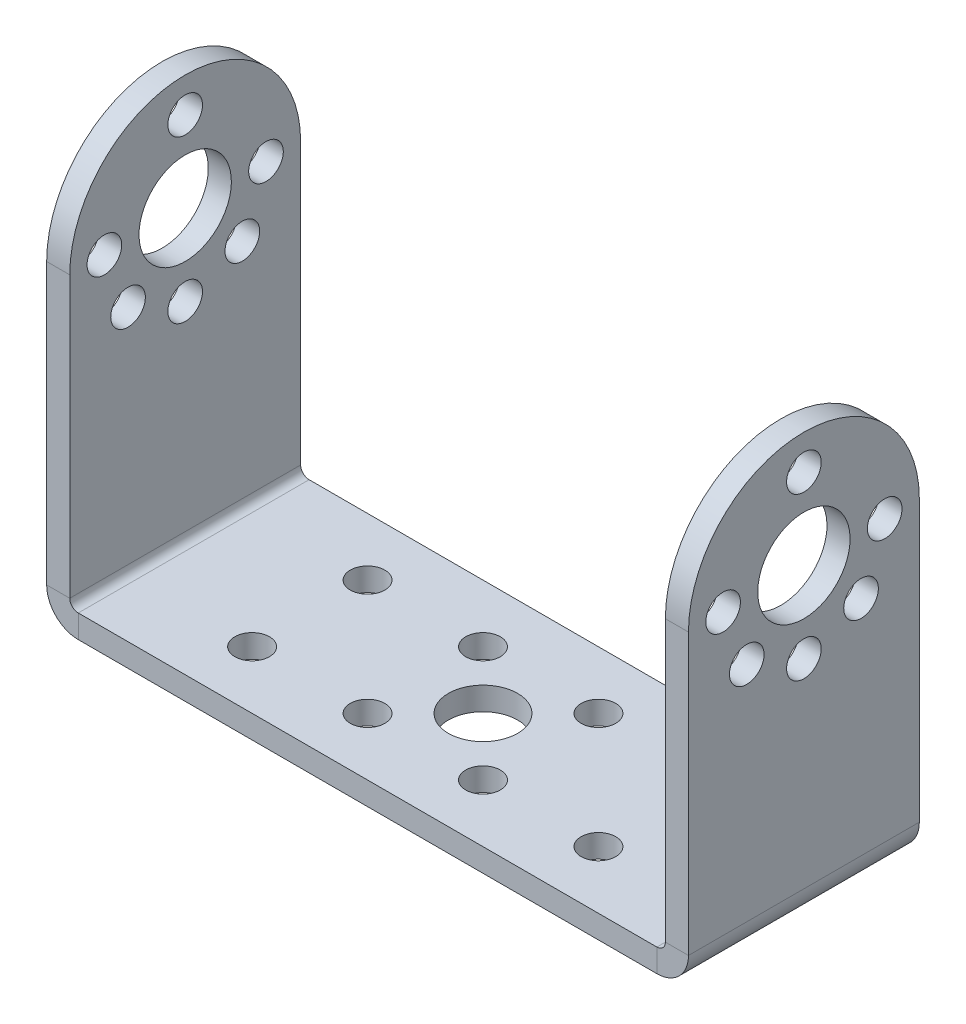
from build123d import *

# Parameters (mm, degrees)
SKETCH_1_W                         = 55.6
SKETCH_1_H                         = 20
SM_BASE_FLANGE_1_DEPTH             = 2
SM_EDGE_FLANGE_1_STRIP_W           = 9.4732
SM_EDGE_FLANGE_1_STRIP_H           = 2
SM_EDGE_FLANGE_1_STRIP_CUT_DEPTH   = 20
SM_EDGE_FLANGE_1_STRIP_2_W         = 9.4732
SM_EDGE_FLANGE_1_STRIP_2_H         = 2
SM_EDGE_FLANGE_1_STRIP_CUT_2_DEPTH = 20
SM_EDGE_FLANGE_1_DEPTH             = 20
SM_EDGE_FLANGE_1_BEND_DEPTH        = 20
SKETCH_12_R                        = 1.5
CUT_EXTRUDE_1_DEPTH                = 67.45569953
SKETCH_13_R                        = 3
SKETCH_13_R_2                      = 1.5
CUT_EXTRUDE_2_DEPTH                = 48.348072822


# Sheet-metal steps are written as plain solids
with BuildPart() as part:
    # Sketch 1 → 基体-法兰1 (new body)
    with BuildSketch(Plane(origin=(0, 0, 0), x_dir=(1, 0, 0), z_dir=(0, 1, 0))):
        Rectangle(SKETCH_1_W, SKETCH_1_H)
    extrude(amount=-SM_BASE_FLANGE_1_DEPTH)

    # 边线-法兰1 strip (across the edge) → 边线-法兰1 strip cut (cut)
    with BuildSketch(Plane(origin=(-27.8, 0, -10), x_dir=(1, 0, 0), z_dir=(0, 0, 1))):
        with Locations((-2, -1)):
            Rectangle(SM_EDGE_FLANGE_1_STRIP_W, SM_EDGE_FLANGE_1_STRIP_H)
    extrude(amount=SM_EDGE_FLANGE_1_STRIP_CUT_DEPTH, mode=Mode.SUBTRACT)

    # 边线-法兰1 strip 2 (across the edge) → 边线-法兰1 strip cut 2 (cut)
    with BuildSketch(Plane(origin=(27.8, 0, 10), x_dir=(-1, 0, 0), z_dir=(0, 0, -1))):
        with Locations((-2, -1)):
            Rectangle(SM_EDGE_FLANGE_1_STRIP_2_W, SM_EDGE_FLANGE_1_STRIP_2_H)
    extrude(amount=SM_EDGE_FLANGE_1_STRIP_CUT_2_DEPTH, mode=Mode.SUBTRACT)

    # 边线-法兰1 section (across the edge) → 边线-法兰1 (add)
    with BuildSketch(Plane(origin=(-27.8, 0, -10), x_dir=(1, 0, 0), z_dir=(0, 0, 1))):
        with BuildLine():
            Line((0, 0.7366), (0, 35))
            Line((0, 35), (2, 35))
            Line((2, 35), (2, 0.7366))
            ThreePointArc((2, 0.7366), (2.215745145, 0.215745145), (2.7366, 0))
            Line((2.7366, 0), (2.7366, -2))
            ThreePointArc((2.7366, -2), (0.801531583, -1.198468417), (0, 0.7366))
        make_face()
    extrude(amount=SM_EDGE_FLANGE_1_DEPTH)

    # 边线-法兰1 section 2 (across the edge) → 边线-法兰1 bend (add)
    with BuildSketch(Plane(origin=(27.8, 0, 10), x_dir=(-1, 0, 0), z_dir=(0, 0, -1))):
        with BuildLine():
            Line((0, 0.7366), (0, 35))
            Line((0, 35), (2, 35))
            Line((2, 35), (2, 0.7366))
            ThreePointArc((2, 0.7366), (2.215745145, 0.215745145), (2.7366, 0))
            Line((2.7366, 0), (2.7366, -2))
            ThreePointArc((2.7366, -2), (0.801531583, -1.198468417), (0, 0.7366))
        make_face()
    extrude(amount=SM_EDGE_FLANGE_1_BEND_DEPTH)

    # 草图12 → 切除-拉伸1 (cut, through all)
    with BuildSketch(Plane(origin=(27.8, 0, 0), x_dir=(0, 0, -1), z_dir=(1, 0, 0))):
        with BuildLine():
            Line((-10, 35), (-10, 25))
            ThreePointArc((-10, 25), (-7.071067812, 32.071067812), (0, 35))
            Line((0, 35), (-10, 35))
        make_face()
        with BuildLine():
            ThreePointArc((0, 35), (7.071067812, 32.071067812), (10, 25))
            Line((10, 25), (10, 35))
            Line((10, 35), (0, 35))
        make_face()
        with BuildLine():
            ThreePointArc((0, 29), (-4, 25), (0, 21))
            Line((0, 21), (0, 29))
        make_face()
        with BuildLine():
            Line((0, 29), (0, 21))
            ThreePointArc((0, 21), (2.828427125, 22.171572875), (4, 25))
            ThreePointArc((4, 25), (2.828427125, 27.828427125), (0, 29))
        make_face()
        with Locations(Location((-7, 25, 0), (0, 0, 90))):
            Circle(SKETCH_12_R)
        with Locations(Location((-4.949747468, 20.050252532, 0), (0, 0, 90))):
            Circle(SKETCH_12_R)
        with Locations(Location((0, 18, 0), (0, 0, 90))):
            Circle(SKETCH_12_R)
        with Locations(Location((4.949747468, 20.050252532, 0), (0, 0, 90))):
            Circle(SKETCH_12_R)
        with Locations(Location((7, 25, 0), (0, 0, 90))):
            Circle(SKETCH_12_R)
        with Locations(Location((0, 32, 0), (0, 0, 90))):
            Circle(SKETCH_12_R)
    extrude(amount=-CUT_EXTRUDE_1_DEPTH, mode=Mode.SUBTRACT)

    # 草图13 → 切除-拉伸2 (cut, through all)
    with BuildSketch(Plane.XZ.offset(2)):
        with Locations(Location((0, 0, 0), (0, 0, 270))):
            Circle(SKETCH_13_R)
        with Locations(Location((-15, 5, 0), (0, 0, 270))):
            Circle(SKETCH_13_R_2)
        with Locations(Location((-5, 5, 0), (0, 0, 270))):
            Circle(SKETCH_13_R_2)
        with Locations(Location((5, 5, 0), (0, 0, 270))):
            Circle(SKETCH_13_R_2)
        with Locations(Location((15, 5, 0), (0, 0, 270))):
            Circle(SKETCH_13_R_2)
        with Locations(Location((-5, -5, 0), (0, 0, 270))):
            Circle(SKETCH_13_R_2)
        with Locations(Location((5, -5, 0), (0, 0, 270))):
            Circle(SKETCH_13_R_2)
        with Locations(Location((15, -5, 0), (0, 0, 270))):
            Circle(SKETCH_13_R_2)
        with Locations(Location((-15, -5, 0), (0, 0, 270))):
            Circle(SKETCH_13_R_2)
    extrude(amount=-CUT_EXTRUDE_2_DEPTH, mode=Mode.SUBTRACT)


solid = part.part
